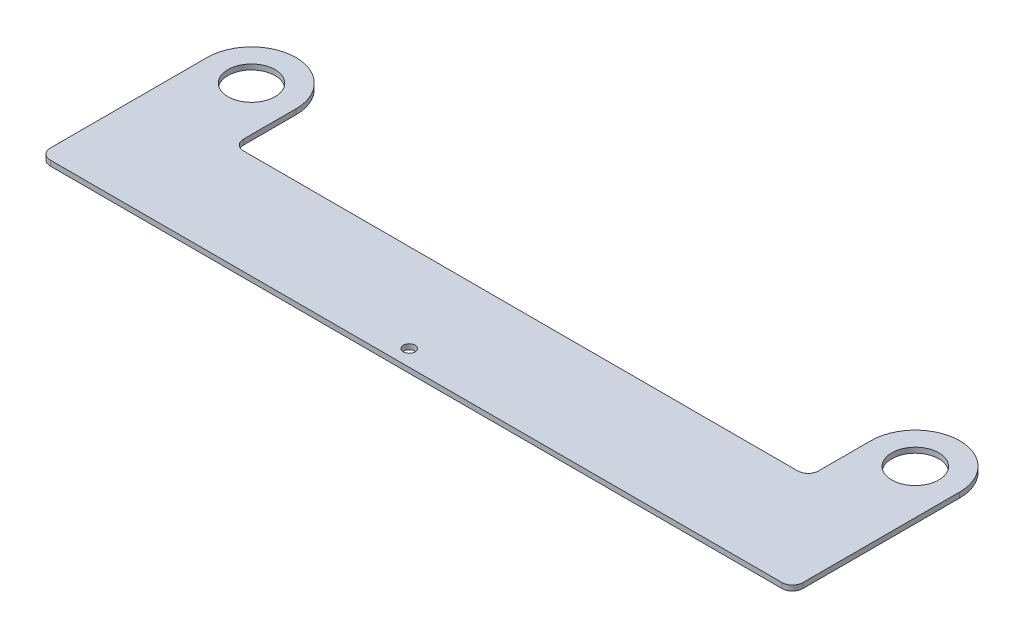
from build123d import *

# Parameters (mm, degrees)
SKETCH1_R           = 14.2875
BOSS_EXTRUDE1_DEPTH = 3.175
CUT_EXTRUDE1_REACH  = 444.058
SKETCH2_R           = 3.556


with BuildPart() as part:
    # Sketch1 → Boss-Extrude1 (new body)
    with BuildSketch(Plane(origin=(0, 0, 0), x_dir=(1, 0, 0), z_dir=(0, 1, 0))):
        with BuildLine():
            Line((-26.9875, 0), (-26.9875, -95.25))
            ThreePointArc((-26.9875, -95.25), (-25.127628061, -99.740128061), (-20.6375, -101.6))
            Line((-20.6375, -101.6), (423.8625, -101.6))
            ThreePointArc((423.8625, -101.6), (428.352628061, -99.740128061), (430.2125, -95.25))
            Line((430.2125, -95.25), (430.2125, 0))
            ThreePointArc((430.2125, 0), (403.225, 26.9875), (376.2375, 0))
            Line((376.2375, 0), (376.2375, -31.75))
            ThreePointArc((376.2375, -31.75), (374.377628061, -36.240128061), (369.8875, -38.1))
            Line((369.8875, -38.1), (33.3375, -38.1))
            ThreePointArc((33.3375, -38.1), (28.847371939, -36.240128061), (26.9875, -31.75))
            Line((26.9875, -31.75), (26.9875, 0))
            ThreePointArc((26.9875, 0), (0, 26.9875), (-26.9875, 0))
        make_face()
        Circle(SKETCH1_R, mode=Mode.SUBTRACT)
        with Locations((403.225, 0)):
            Circle(SKETCH1_R, mode=Mode.SUBTRACT)
    extrude(amount=BOSS_EXTRUDE1_DEPTH)

    # Sketch2 → Cut-Extrude1 (cut, up to next)
    with BuildSketch(Plane(origin=(0, 3.175, 0), x_dir=(1, 0, 0), z_dir=(0, 1, 0)), mode=Mode.PRIVATE) as cut_extrude1_sk1:
        with Locations((187.509141167, -91.707724563)):
            Circle(SKETCH2_R)
    cut_extrude1_tool1 = extrude(cut_extrude1_sk1.sketch, amount=-CUT_EXTRUDE1_REACH, mode=Mode.PRIVATE) & part.part
    add(cut_extrude1_tool1.solids().sort_by_distance((187.509141, 3.175, 91.707725))[0], mode=Mode.SUBTRACT)


solid = part.part
